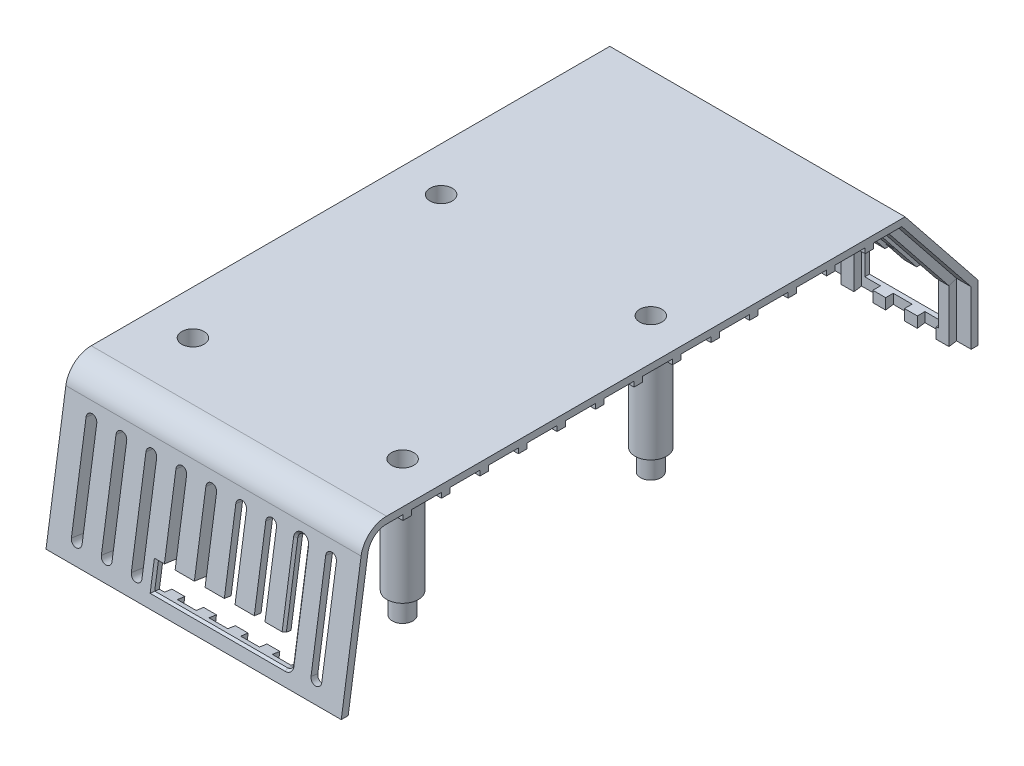
from build123d import *

# Parameters (mm, degrees)
EXTRUDE_1_DEPTH      = 69
SKETCH_7_W           = 3
SKETCH_7_H           = 1.8
SKETCH_18_R          = 3.7
EXTRUDE_2_DEPTH      = 30
EXTRUDE_START        = -69
SKETCH_28_W          = 2
SKETCH_28_H          = 1.2
EXTRUDE_3_DEPTH      = 69
SKETCH_27_R          = 2.6
CUT_EXTRUDE_6_DEPTH  = 25
CUT_EXTRUDE_7_REACH  = 169.39
SKETCH_29_R          = 1.35
SKETCH_30_R          = 4
SKETCH_30_R_2        = 2.4
CUT_EXTRUDE_8_DEPTH  = 5
CUT_EXTRUDE_9_REACH  = 177.052
CUT_EXTRUDE_10_REACH = 164.542
CUT_EXTRUDE_START    = -3.379506
SKETCH_33_W          = 31.085842881
SKETCH_33_H          = 6.2
CUT_EXTRUDE_11_DEPTH = 3.379506
CUT_EXTRUDE_12_REACH = 170.6
SKETCH_34_W          = 19
SKETCH_34_H          = 10
CHAMFER_1_SIZE       = 0.5


with BuildPart() as part:
    # 草图2 → 凸台-拉伸1 (new body)
    with BuildSketch(Plane(origin=(0, 0, 0), x_dir=(0, 0, -1), z_dir=(1, 0, 0))):
        with BuildLine():
            Line((-2.001625282, 4.5), (-2.001625282, 17.164444968))
            Line((-2.001625282, 17.164444968), (-18.214026207, 37.447074334))
            Line((-18.214026207, 37.447074334), (-138.628938569, 37.447074334))
            ThreePointArc((-138.628938569, 37.447074334), (-141.499289796, 36.38190324), (-142.979906861, 33.70211244))
            Line((-142.979906861, 33.70211244), (-147.376283751, 4.5))
            Line((-147.376283751, 4.5), (-147.579526198, 3.15))
            Line((-147.579526198, 3.15), (-149.197556836, 3.15))
            Line((-149.197556836, 3.15), (-148.994314388, 4.5))
            Line((-148.994314388, 4.5), (-144.562077149, 33.940308116))
            ThreePointArc((-144.562077149, 33.940308116), (-142.543053879, 37.594568297), (-138.628938569, 39.047074334))
            Line((-138.628938569, 39.047074334), (-17.444620599, 39.047074334))
            Line((-17.444620599, 39.047074334), (-0.401625282, 17.725324466))
            Line((-0.401625282, 17.725324466), (-0.401625282, 4.5))
            Line((-0.401625282, 4.5), (-2.001625282, 4.5))
        make_face()
    extrude(amount=EXTRUDE_1_DEPTH)

    # 扫描1: sweep along a path in 草图17
    with BuildLine(Plane.ZY) as sweep_1_path:
        Line((147.579526198, 3.15), (143.056789207, 33.191435819))
        ThreePointArc((143.056789207, 33.191435819), (141.374269815, 36.236652636), (138.112507057, 37.447074334))
        Line((138.112507057, 37.447074334), (18.214026207, 37.447074334))
        Line((18.214026207, 37.447074334), (2.001625282, 17.164444968))
        Line((2.001625282, 17.164444968), (2.001625282, 4.5))
    # 草图7 → 扫描1 (sweep)
    with BuildSketch(Plane.XZ.offset(-3.15)):
        with Locations((34.5, 146.679966657)):
            Rectangle(SKETCH_7_W, SKETCH_7_H)
        with Locations((27.1, 146.679966657)):
            Rectangle(SKETCH_7_W, SKETCH_7_H)
        with Locations((19.7, 146.679966657)):
            Rectangle(SKETCH_7_W, SKETCH_7_H)
        with Locations((12.3, 146.679966657)):
            Rectangle(SKETCH_7_W, SKETCH_7_H)
        with Locations((4.9, 146.679966657)):
            Rectangle(SKETCH_7_W, SKETCH_7_H)
        with Locations((41.9, 146.679966657)):
            Rectangle(SKETCH_7_W, SKETCH_7_H)
        with Locations((49.3, 146.679966657)):
            Rectangle(SKETCH_7_W, SKETCH_7_H)
        with Locations((56.7, 146.679966657)):
            Rectangle(SKETCH_7_W, SKETCH_7_H)
        with Locations((64.1, 146.679966657)):
            Rectangle(SKETCH_7_W, SKETCH_7_H)
    sweep(path=sweep_1_path.line, transition=Transition.RIGHT)

    # 草图18 → 凸台-拉伸2 (add)
    with BuildSketch(Plane.XZ.offset(-37.447074334)):
        with Locations(Location((59.3, 67.161625282, 0), (0, 0, 107.295344629))):
            Circle(SKETCH_18_R)
        with Locations(Location((59.3, 125.161625282, 0), (0, 0, 107.295344629))):
            Circle(SKETCH_18_R)
        with Locations(Location((10.3, 125.161625282, 0), (0, 0, 82.233565831))):
            Circle(SKETCH_18_R)
        with Locations(Location((10.3, 67.161625282, 0), (0, 0, 82.233565831))):
            Circle(SKETCH_18_R)
    extrude(amount=EXTRUDE_2_DEPTH)

    # 草图28 → 凸台-拉伸3 (add)
    with BuildSketch(Plane(origin=(69, 0, 0), x_dir=(0, 0, -1), z_dir=(1, 0, 0)).offset(EXTRUDE_START)):
        with Locations((-133.786467665, 36.847074334)):
            Rectangle(SKETCH_28_W, SKETCH_28_H)
        with Locations((-124.786467665, 36.847074334)):
            Rectangle(SKETCH_28_W, SKETCH_28_H)
        with Locations((-115.786467665, 36.847074334)):
            Rectangle(SKETCH_28_W, SKETCH_28_H)
        with Locations((-106.786467665, 36.847074334)):
            Rectangle(SKETCH_28_W, SKETCH_28_H)
        with Locations((-97.786467665, 36.847074334)):
            Rectangle(SKETCH_28_W, SKETCH_28_H)
        with Locations((-88.786467665, 36.847074334)):
            Rectangle(SKETCH_28_W, SKETCH_28_H)
        with Locations((-79.786467665, 36.847074334)):
            Rectangle(SKETCH_28_W, SKETCH_28_H)
        with Locations((-70.786467665, 36.847074334)):
            Rectangle(SKETCH_28_W, SKETCH_28_H)
        with Locations((-61.786467665, 36.847074334)):
            Rectangle(SKETCH_28_W, SKETCH_28_H)
        with Locations((-52.786467665, 36.847074334)):
            Rectangle(SKETCH_28_W, SKETCH_28_H)
        with Locations((-43.786467665, 36.847074334)):
            Rectangle(SKETCH_28_W, SKETCH_28_H)
        with Locations((-34.786467665, 36.847074334)):
            Rectangle(SKETCH_28_W, SKETCH_28_H)
        with Locations((-25.786467665, 36.847074334)):
            Rectangle(SKETCH_28_W, SKETCH_28_H)
    extrude(amount=EXTRUDE_3_DEPTH)

    # 草图27 → 切除-拉伸6 (cut)
    with BuildSketch(Plane(origin=(0, 39.047074334, 0), x_dir=(1, 0, 0), z_dir=(0, 1, 0))):
        with Locations(Location((10.3, -67.161625282, 0), (0, 0, 270))):
            Circle(SKETCH_27_R)
        with Locations(Location((59.3, -125.161625282, 0), (0, 0, 270))):
            Circle(SKETCH_27_R)
        with Locations(Location((10.3, -125.161625282, 0), (0, 0, 270))):
            Circle(SKETCH_27_R)
        with Locations(Location((59.3, -67.161625282, 0), (0, 0, 270))):
            Circle(SKETCH_27_R)
    extrude(amount=-CUT_EXTRUDE_6_DEPTH, mode=Mode.SUBTRACT)

    # 草图29 → 切除-拉伸7 (cut, up to next)
    with BuildSketch(Plane.XZ.offset(-7.447074334), mode=Mode.PRIVATE) as cut_extrude_7_sk1:
        with Locations(Location((59.3, 67.161625282, 0), (0, 0, 270))):
            Circle(SKETCH_29_R)
    cut_extrude_7_tool1 = extrude(cut_extrude_7_sk1.sketch, amount=-CUT_EXTRUDE_7_REACH, mode=Mode.PRIVATE) & part.part
    # 草图29 → 切除-拉伸7 (cut, up to next)
    with BuildSketch(Plane.XZ.offset(-7.447074334), mode=Mode.PRIVATE) as cut_extrude_7_sk2:
        with Locations(Location((10.3, 67.161625282, 0), (0, 0, 270))):
            Circle(SKETCH_29_R)
    cut_extrude_7_tool2 = extrude(cut_extrude_7_sk2.sketch, amount=-CUT_EXTRUDE_7_REACH, mode=Mode.PRIVATE) & part.part
    # 草图29 → 切除-拉伸7 (cut, up to next)
    with BuildSketch(Plane.XZ.offset(-7.447074334), mode=Mode.PRIVATE) as cut_extrude_7_sk3:
        with Locations(Location((10.3, 125.161625282, 0), (0, 0, 270))):
            Circle(SKETCH_29_R)
    cut_extrude_7_tool3 = extrude(cut_extrude_7_sk3.sketch, amount=-CUT_EXTRUDE_7_REACH, mode=Mode.PRIVATE) & part.part
    # 草图29 → 切除-拉伸7 (cut, up to next)
    with BuildSketch(Plane.XZ.offset(-7.447074334), mode=Mode.PRIVATE) as cut_extrude_7_sk4:
        with Locations(Location((59.3, 125.161625282, 0), (0, 0, 270))):
            Circle(SKETCH_29_R)
    cut_extrude_7_tool4 = extrude(cut_extrude_7_sk4.sketch, amount=-CUT_EXTRUDE_7_REACH, mode=Mode.PRIVATE) & part.part
    add(cut_extrude_7_tool1.solids().sort_by_distance((59.3, 7.447074, 67.161625))[0], mode=Mode.SUBTRACT)
    add(cut_extrude_7_tool2.solids().sort_by_distance((10.3, 7.447074, 67.161625))[0], mode=Mode.SUBTRACT)
    add(cut_extrude_7_tool3.solids().sort_by_distance((10.3, 7.447074, 125.161625))[0], mode=Mode.SUBTRACT)
    add(cut_extrude_7_tool4.solids().sort_by_distance((59.3, 7.447074, 125.161625))[0], mode=Mode.SUBTRACT)

    # 草图30 → 切除-拉伸8 (cut)
    # profile 1 of 4: a face of its own
    with BuildSketch(Plane.XZ.offset(-7.447074334)):
        with Locations((59.3, 67.161625282)):
            Circle(SKETCH_30_R)
        with Locations(Location((59.3, 67.161625282, 0), (0, 0, 270))):
            Circle(SKETCH_30_R_2, mode=Mode.SUBTRACT)
    # profile 2 of 4: a face of its own
    with BuildSketch(Plane.XZ.offset(-7.447074334)):
        with Locations((10.3, 67.161625282)):
            Circle(SKETCH_30_R)
        with Locations(Location((10.3, 67.161625282, 0), (0, 0, 270))):
            Circle(SKETCH_30_R_2, mode=Mode.SUBTRACT)
    # profile 3 of 4: a face of its own
    with BuildSketch(Plane.XZ.offset(-7.447074334)):
        with Locations((10.3, 125.161625282)):
            Circle(SKETCH_30_R)
        with Locations(Location((10.3, 125.161625282, 0), (0, 0, 270))):
            Circle(SKETCH_30_R_2, mode=Mode.SUBTRACT)
    # profile 4 of 4: a face of its own
    with BuildSketch(Plane.XZ.offset(-7.447074334)):
        with Locations((59.3, 125.161625282)):
            Circle(SKETCH_30_R)
        with Locations(Location((59.3, 125.161625282, 0), (0, 0, 270))):
            Circle(SKETCH_30_R_2, mode=Mode.SUBTRACT)
    extrude(amount=-CUT_EXTRUDE_8_DEPTH, mode=Mode.SUBTRACT)

    # 草图31 → 切除-拉伸9 (cut, up to next)
    with BuildSketch(Plane(origin=(0, 6.714196053, -8.399838534), x_dir=(-1, 0, 0), z_dir=(0, 0.624373217491497, -0.7811261647642562)), mode=Mode.PRIVATE) as cut_extrude_9_sk1:
        Polygon((-56.770892384, 34.156163026), (-54.232430846, 34.156163026), (-51.725219307, 30.302797642), (-49.213200076, 34.156163026), (-46.672334692, 34.156163026), (-50.455988538, 28.353278411), (-46.422334692, 22.156163026), (-48.96079623, 22.156163026), (-51.725219307, 26.406163026), (-54.496853923, 22.156163026), (-57.037719307, 22.156163026), (-52.994450076, 28.355682257), align=None)
    cut_extrude_9_tool1 = extrude(cut_extrude_9_sk1.sketch, amount=-CUT_EXTRUDE_9_REACH, mode=Mode.PRIVATE) & part.part
    # 草图31 → 切除-拉伸9 (cut, up to next)
    with BuildSketch(Plane(origin=(0, 6.714196053, -8.399838534), x_dir=(-1, 0, 0), z_dir=(0, 0.624373217491497, -0.7811261647642562)), mode=Mode.PRIVATE) as cut_extrude_9_sk2:
        Polygon((-39.24204623, 34.156163026), (-37.006469307, 34.156163026), (-34.268488538, 25.785970719), (-31.511277, 34.156163026), (-29.297334692, 34.156163026), (-27.268488538, 22.156163026), (-29.448777, 22.156163026), (-30.730027, 29.735489949), (-33.225219307, 22.156163026), (-35.326180846, 22.156163026), (-37.806950076, 29.735489949), (-39.08579623, 22.156163026), (-41.268488538, 22.156163026), align=None)
    cut_extrude_9_tool2 = extrude(cut_extrude_9_sk2.sketch, amount=-CUT_EXTRUDE_9_REACH, mode=Mode.PRIVATE) & part.part
    # 草图31 → 切除-拉伸9 (cut, up to next)
    with BuildSketch(Plane(origin=(0, 6.714196053, -8.399838534), x_dir=(-1, 0, 0), z_dir=(0, 0.624373217491497, -0.7811261647642562)), mode=Mode.PRIVATE) as cut_extrude_9_sk3:
        with BuildLine():
            Line((-20.653103923, 34.156163026), (-18.499257769, 34.156163026))
            Line((-18.499257769, 34.156163026), (-18.499257769, 26.348470719))
            add(Edge.make_bspline(
                [(-18.499257769, 26.348470719), (-18.499140653, 26.267523951), (-18.498914446, 26.111176106), (-18.487590384, 25.886868138), (-18.477228086, 25.680682149), (-18.458531559, 25.492843871), (-18.430910381, 25.323272952), (-18.404164068, 25.170880129), (-18.367965578, 25.038393824), (-18.313565035, 24.887589722), (-18.229751655, 24.718153077), (-18.092805244, 24.541562319), (-17.934780801, 24.380397621), (-17.745379404, 24.246250232), (-17.532508984, 24.137737086), (-17.29733917, 24.057340854), (-17.040201466, 24.012651223), (-16.862404849, 24.005828532), (-16.770892384, 24.002316872)],
                knots=[0, 0, 0, 0, 1.155499968, 2.231836252, 3.205919964, 4.102923608, 4.924856345, 5.658536265, 6.31071849, 6.882491295, 7.94666036, 8.992281882, 10.060072772, 11.158554251, 12.289267114, 13.461410017, 14.693379945, 16, 16, 16, 16], degree=3))
            add(Edge.make_bspline(
                [(-16.770892384, 24.002316872), (-16.673671684, 24.005153843), (-16.484107778, 24.010685455), (-16.211450278, 24.064984213), (-15.958831557, 24.151446433), (-15.731600417, 24.274850057), (-15.529982988, 24.422770926), (-15.359318059, 24.591447071), (-15.224629924, 24.781214917), (-15.136845208, 24.956290205), (-15.087558414, 25.117431762), (-15.050615506, 25.261405629), (-15.023532267, 25.43128054), (-14.998961463, 25.624403533), (-14.984196303, 25.842774989), (-14.968185894, 26.084638738), (-14.96231793, 26.351649676), (-14.961317779, 26.537574403), (-14.96079623, 26.634528411)],
                knots=[0, 0, 0, 0, 1.261321664, 2.459363699, 3.594844139, 4.716940403, 5.803436589, 6.833651888, 7.818396249, 8.814403945, 9.360733334, 10.004355033, 10.743453831, 11.592799886, 12.532235708, 13.585170094, 14.740740724, 16, 16, 16, 16], degree=3))
            Line((-14.96079623, 26.634528411), (-14.96079623, 34.156163026))
            Line((-14.96079623, 34.156163026), (-12.806950076, 34.156163026))
            Line((-12.806950076, 34.156163026), (-12.806950076, 26.99750918))
            add(Edge.make_bspline(
                [(-12.806950076, 26.99750918), (-12.807249177, 26.852475195), (-12.807824319, 26.573588987), (-12.816656757, 26.17280988), (-12.835459422, 25.806762454), (-12.851251491, 25.47533975), (-12.881814553, 25.17898825), (-12.913654094, 24.916442448), (-12.954236328, 24.688632747), (-13.014620253, 24.429299087), (-13.11882503, 24.130685876), (-13.286816792, 23.786845707), (-13.50007146, 23.450205355), (-13.752127821, 23.124468094), (-14.036722509, 22.821868677), (-14.34754545, 22.556225557), (-14.679658441, 22.331520122), (-15.036531824, 22.153246692), (-15.417861882, 22.014206856), (-15.827421591, 21.920779089), (-16.264931663, 21.857658117), (-16.56712814, 21.851594571), (-16.722815461, 21.848470719)],
                knots=[0, 0, 0, 0, 1.170808336, 2.251350247, 3.235597562, 4.129743112, 4.929140599, 5.639994148, 6.264258765, 6.79612947, 7.788252245, 8.809469599, 9.879094798, 10.999557536, 12.129761673, 13.226370002, 14.293821979, 15.358369427, 16.438775801, 17.562147481, 18.744053101, 20, 20, 20, 20], degree=3))
            add(Edge.make_bspline(
                [(-16.722815461, 21.848470719), (-16.826257214, 21.850213058), (-17.030345672, 21.853650659), (-17.330493552, 21.883961316), (-17.620645438, 21.928627827), (-17.900256137, 21.993791668), (-18.170296126, 22.077971179), (-18.430693662, 22.181590294), (-18.680481044, 22.30407104), (-18.918260496, 22.444286859), (-19.143739412, 22.595906129), (-19.349815502, 22.763982472), (-19.543580328, 22.936086008), (-19.719436106, 23.119459585), (-19.878703668, 23.312178092), (-20.021055003, 23.514678292), (-20.146278625, 23.7269422), (-20.257524464, 23.952795859), (-20.352740045, 24.203718596), (-20.433010356, 24.488635835), (-20.50313639, 24.812013371), (-20.55524992, 25.174579754), (-20.602496352, 25.575140008), (-20.632400739, 26.014737651), (-20.64804507, 26.493385298), (-20.651375029, 26.825221789), (-20.653103923, 26.99750918)],
                knots=[0, 0, 0, 0, 1.001158378, 1.975264943, 2.917723546, 3.841610987, 4.75185031, 5.653588123, 6.552117133, 7.442167995, 8.324307438, 9.179605724, 10.014504199, 10.831958861, 11.636465792, 12.43274043, 13.225645099, 14.020104002, 14.867201867, 15.819789774, 16.883317127, 18.068162734, 19.364263498, 20.787406516, 22.332041935, 24, 24, 24, 24], degree=3))
            Line((-20.653103923, 26.99750918), (-20.653103923, 34.156163026))
        make_face()
    cut_extrude_9_tool3 = extrude(cut_extrude_9_sk3.sketch, amount=-CUT_EXTRUDE_9_REACH, mode=Mode.PRIVATE) & part.part
    add(cut_extrude_9_tool1.solids().sort_by_distance((51.725705, 28.694008, 9.169162))[0], mode=Mode.SUBTRACT)
    add(cut_extrude_9_tool2.solids().sort_by_distance((38.124258, 33.250436, 12.811226))[0], mode=Mode.SUBTRACT)
    add(cut_extrude_9_tool3.solids().sort_by_distance((19.576181, 33.280456, 12.835222))[0], mode=Mode.SUBTRACT)

    # 草图32 → 切除-拉伸10 (cut, up to next)
    with BuildSketch(Plane(origin=(0, 22.033682216, 146.354619214), x_dir=(1, 0, 0), z_dir=(0, 0.14887229698271995, 0.9888564300195903)), mode=Mode.PRIVATE) as cut_extrude_10_sk1:
        with BuildLine():
            Line((35.75, 8.5), (35.75, -14.5))
            ThreePointArc((35.75, -14.5), (34.5, -15.75), (33.25, -14.5))
            Line((33.25, -14.5), (33.25, 8.5))
            ThreePointArc((33.25, 8.5), (34.5, 9.75), (35.75, 8.5))
        make_face()
    cut_extrude_10_tool1 = extrude(cut_extrude_10_sk1.sketch, amount=-CUT_EXTRUDE_10_REACH, mode=Mode.PRIVATE) & part.part
    # 草图32 → 切除-拉伸10 (cut, up to next)
    with BuildSketch(Plane(origin=(0, 22.033682216, 146.354619214), x_dir=(1, 0, 0), z_dir=(0, 0.14887229698271995, 0.9888564300195903)), mode=Mode.PRIVATE) as cut_extrude_10_sk2:
        with BuildLine():
            Line((42.75, 8.5), (42.75, -14.5))
            ThreePointArc((42.75, -14.5), (41.5, -15.75), (40.25, -14.5))
            Line((40.25, -14.5), (40.25, 8.5))
            ThreePointArc((40.25, 8.5), (41.5, 9.75), (42.75, 8.5))
        make_face()
    cut_extrude_10_tool2 = extrude(cut_extrude_10_sk2.sketch, amount=-CUT_EXTRUDE_10_REACH, mode=Mode.PRIVATE) & part.part
    # 草图32 → 切除-拉伸10 (cut, up to next)
    with BuildSketch(Plane(origin=(0, 22.033682216, 146.354619214), x_dir=(1, 0, 0), z_dir=(0, 0.14887229698271995, 0.9888564300195903)), mode=Mode.PRIVATE) as cut_extrude_10_sk3:
        with BuildLine():
            Line((49.75, 8.5), (49.75, -14.5))
            ThreePointArc((49.75, -14.5), (48.5, -15.75), (47.25, -14.5))
            Line((47.25, -14.5), (47.25, 8.5))
            ThreePointArc((47.25, 8.5), (48.5, 9.75), (49.75, 8.5))
        make_face()
    cut_extrude_10_tool3 = extrude(cut_extrude_10_sk3.sketch, amount=-CUT_EXTRUDE_10_REACH, mode=Mode.PRIVATE) & part.part
    # 草图32 → 切除-拉伸10 (cut, up to next)
    with BuildSketch(Plane(origin=(0, 22.033682216, 146.354619214), x_dir=(1, 0, 0), z_dir=(0, 0.14887229698271995, 0.9888564300195903)), mode=Mode.PRIVATE) as cut_extrude_10_sk4:
        with BuildLine():
            Line((56.75, 8.5), (56.75, -14.5))
            ThreePointArc((56.75, -14.5), (55.5, -15.75), (54.25, -14.5))
            Line((54.25, -14.5), (54.25, 8.5))
            ThreePointArc((54.25, 8.5), (55.5, 9.75), (56.75, 8.5))
        make_face()
    cut_extrude_10_tool4 = extrude(cut_extrude_10_sk4.sketch, amount=-CUT_EXTRUDE_10_REACH, mode=Mode.PRIVATE) & part.part
    # 草图32 → 切除-拉伸10 (cut, up to next)
    with BuildSketch(Plane(origin=(0, 22.033682216, 146.354619214), x_dir=(1, 0, 0), z_dir=(0, 0.14887229698271995, 0.9888564300195903)), mode=Mode.PRIVATE) as cut_extrude_10_sk5:
        with BuildLine():
            Line((63.75, 8.5), (63.75, -14.5))
            ThreePointArc((63.75, -14.5), (62.5, -15.75), (61.25, -14.5))
            Line((61.25, -14.5), (61.25, 8.5))
            ThreePointArc((61.25, 8.5), (62.5, 9.75), (63.75, 8.5))
        make_face()
    cut_extrude_10_tool5 = extrude(cut_extrude_10_sk5.sketch, amount=-CUT_EXTRUDE_10_REACH, mode=Mode.PRIVATE) & part.part
    # 草图32 → 切除-拉伸10 (cut, up to next)
    with BuildSketch(Plane(origin=(0, 22.033682216, 146.354619214), x_dir=(1, 0, 0), z_dir=(0, 0.14887229698271995, 0.9888564300195903)), mode=Mode.PRIVATE) as cut_extrude_10_sk6:
        with BuildLine():
            Line((28.75, 8.5), (28.75, -14.5))
            ThreePointArc((28.75, -14.5), (27.5, -15.75), (26.25, -14.5))
            Line((26.25, -14.5), (26.25, 8.5))
            ThreePointArc((26.25, 8.5), (27.5, 9.75), (28.75, 8.5))
        make_face()
    cut_extrude_10_tool6 = extrude(cut_extrude_10_sk6.sketch, amount=-CUT_EXTRUDE_10_REACH, mode=Mode.PRIVATE) & part.part
    # 草图32 → 切除-拉伸10 (cut, up to next)
    with BuildSketch(Plane(origin=(0, 22.033682216, 146.354619214), x_dir=(1, 0, 0), z_dir=(0, 0.14887229698271995, 0.9888564300195903)), mode=Mode.PRIVATE) as cut_extrude_10_sk7:
        with BuildLine():
            Line((21.75, 8.5), (21.75, -14.5))
            ThreePointArc((21.75, -14.5), (20.5, -15.75), (19.25, -14.5))
            Line((19.25, -14.5), (19.25, 8.5))
            ThreePointArc((19.25, 8.5), (20.5, 9.75), (21.75, 8.5))
        make_face()
    cut_extrude_10_tool7 = extrude(cut_extrude_10_sk7.sketch, amount=-CUT_EXTRUDE_10_REACH, mode=Mode.PRIVATE) & part.part
    # 草图32 → 切除-拉伸10 (cut, up to next)
    with BuildSketch(Plane(origin=(0, 22.033682216, 146.354619214), x_dir=(1, 0, 0), z_dir=(0, 0.14887229698271995, 0.9888564300195903)), mode=Mode.PRIVATE) as cut_extrude_10_sk8:
        with BuildLine():
            Line((14.75, 8.5), (14.75, -14.5))
            ThreePointArc((14.75, -14.5), (13.5, -15.75), (12.25, -14.5))
            Line((12.25, -14.5), (12.25, 8.5))
            ThreePointArc((12.25, 8.5), (13.5, 9.75), (14.75, 8.5))
        make_face()
    cut_extrude_10_tool8 = extrude(cut_extrude_10_sk8.sketch, amount=-CUT_EXTRUDE_10_REACH, mode=Mode.PRIVATE) & part.part
    # 草图32 → 切除-拉伸10 (cut, up to next)
    with BuildSketch(Plane(origin=(0, 22.033682216, 146.354619214), x_dir=(1, 0, 0), z_dir=(0, 0.14887229698271995, 0.9888564300195903)), mode=Mode.PRIVATE) as cut_extrude_10_sk9:
        with BuildLine():
            Line((7.75, 8.5), (7.75, -14.5))
            ThreePointArc((7.75, -14.5), (6.5, -15.75), (5.25, -14.5))
            Line((5.25, -14.5), (5.25, 8.5))
            ThreePointArc((5.25, 8.5), (6.5, 9.75), (7.75, 8.5))
        make_face()
    cut_extrude_10_tool9 = extrude(cut_extrude_10_sk9.sketch, amount=-CUT_EXTRUDE_10_REACH, mode=Mode.PRIVATE) & part.part
    add(cut_extrude_10_tool1.solids().sort_by_distance((34.5, 19.067113, 146.801236))[0], mode=Mode.SUBTRACT)
    add(cut_extrude_10_tool2.solids().sort_by_distance((41.5, 19.067113, 146.801236))[0], mode=Mode.SUBTRACT)
    add(cut_extrude_10_tool3.solids().sort_by_distance((48.5, 19.067113, 146.801236))[0], mode=Mode.SUBTRACT)
    add(cut_extrude_10_tool4.solids().sort_by_distance((55.5, 19.067113, 146.801236))[0], mode=Mode.SUBTRACT)
    add(cut_extrude_10_tool5.solids().sort_by_distance((62.5, 19.067113, 146.801236))[0], mode=Mode.SUBTRACT)
    add(cut_extrude_10_tool6.solids().sort_by_distance((27.5, 19.067113, 146.801236))[0], mode=Mode.SUBTRACT)
    add(cut_extrude_10_tool7.solids().sort_by_distance((20.5, 19.067113, 146.801236))[0], mode=Mode.SUBTRACT)
    add(cut_extrude_10_tool8.solids().sort_by_distance((13.5, 19.067113, 146.801236))[0], mode=Mode.SUBTRACT)
    add(cut_extrude_10_tool9.solids().sort_by_distance((6.5, 19.067113, 146.801236))[0], mode=Mode.SUBTRACT)

    # 草图33 → 切除-拉伸11 (cut)
    with BuildSketch(Plane(origin=(0, 22.033682216, 146.354619214), x_dir=(1, 0, 0), z_dir=(0, 0.14887229698271995, 0.9888564300195903)).offset(CUT_EXTRUDE_START)):
        with Locations((39.95707856, -12.65)):
            Rectangle(SKETCH_33_W, SKETCH_33_H)
    extrude(amount=CUT_EXTRUDE_11_DEPTH, mode=Mode.SUBTRACT)

    # 草图34 → 切除-拉伸12 (cut, up to next)
    with BuildSketch(Plane(origin=(0, 0, 0.401625282), x_dir=(-1, 0, 0), z_dir=(0, 0, -1)), mode=Mode.PRIVATE) as cut_extrude_12_sk1:
        with Locations((-53.65, 11.75)):
            Rectangle(SKETCH_34_W, SKETCH_34_H)
    cut_extrude_12_tool1 = extrude(cut_extrude_12_sk1.sketch, amount=-CUT_EXTRUDE_12_REACH, mode=Mode.PRIVATE) & part.part
    add(cut_extrude_12_tool1.solids().sort_by_distance((53.65, 11.75, 0.401625))[0], mode=Mode.SUBTRACT)

    # 倒角1
    chamfer_1_edges = [part.edges().sort_by_distance(p)[0] for p in [
        (55.5, 31.675032409, 144.903114319),
        (54.25, 21.51453259, 146.43277717),
        (56.75, 19.067112926, 146.801236105),
        (24.414157119, 9.524648376, 148.237853771),
        (39.957078559, 6.459193443, 148.699357892),
        (56.383883476, 6.821230122, 148.644853284),
        (53.65, 6.75, 0.401625282),
        (44.15, 11.75, 0.401625282),
        (53.65, 16.75, 0.401625282),
        (63.15, 11.75, 0.401625282),
    ]]
    chamfer(chamfer_1_edges, length=CHAMFER_1_SIZE)


solid = part.part
